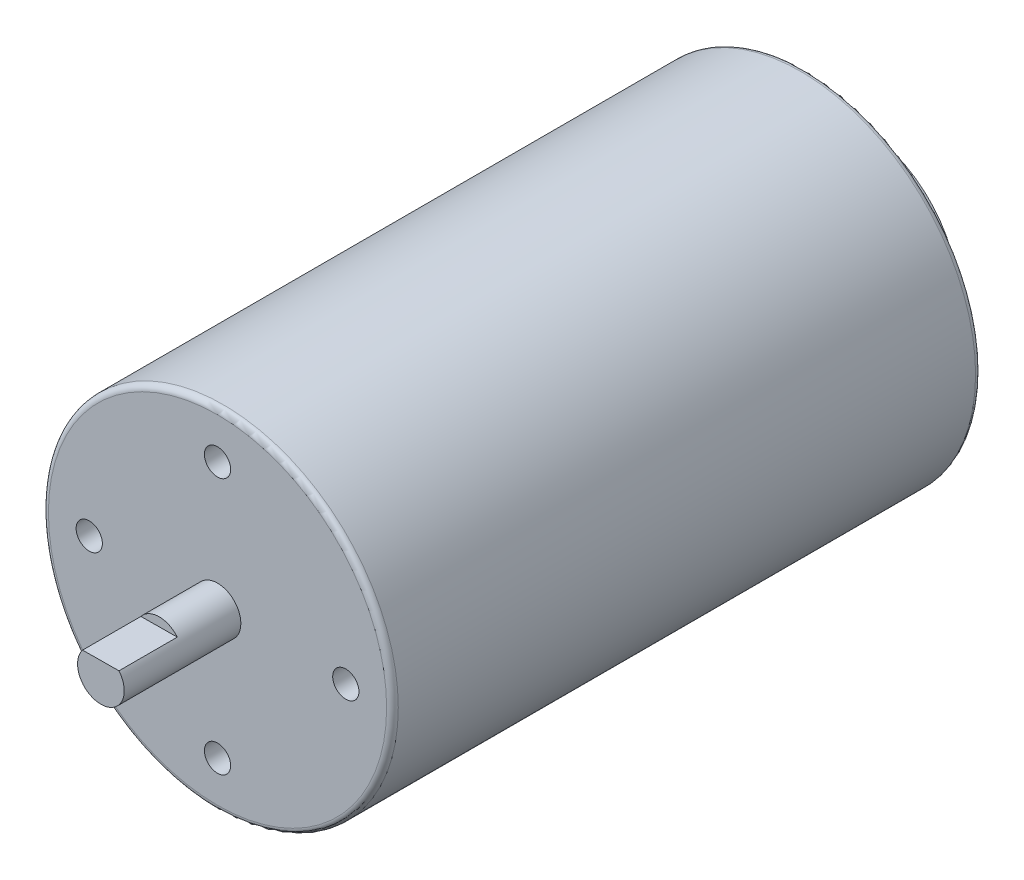
from build123d import *

# Parameters (mm, degrees)
ESQUISSE1_R             = 30
BOSS_EXTRU_1_DEPTH      = 101
ESQUISSE2_R             = 4
BOSS_EXTRU_2_DEPTH      = 20
ENL_V_START             = -10
ENL_V_MAT_EXTRU_1_DEPTH = 10
CONG_1_R                = 1
ESQUISSE4_R             = 17
BOSS_EXTRU_3_DEPTH      = 9
ESQUISSE5_R             = 2.25
ENL_V_MAT_EXTRU_2_DEPTH = 9


with BuildPart() as part:
    # Esquisse1 → Boss.-Extru.1 (new body)
    with BuildSketch(Plane(origin=(0, 0, 0), x_dir=(0, 1, 0), z_dir=(0, 0, 1))):
        Circle(ESQUISSE1_R)
    extrude(amount=BOSS_EXTRU_1_DEPTH)

    # Esquisse2 → Boss.-Extru.2 (add)
    with BuildSketch(Plane.XY.offset(101)):
        Circle(ESQUISSE2_R)
    extrude(amount=BOSS_EXTRU_2_DEPTH)

    # Esquisse3 → Enlèv. mat.-Extru.1 (cut)
    with BuildSketch(Plane.XY.offset(121).offset(ENL_V_START)):
        with BuildLine():
            Line((-3.142677151, 2.4745869), (3.101981411, 2.5254131))
            ThreePointArc((3.101981411, 2.5254131), (-0.032555514, 3.999867515), (-3.142677151, 2.4745869))
        make_face()
    extrude(amount=ENL_V_MAT_EXTRU_1_DEPTH, mode=Mode.SUBTRACT)

    # Congé1
    cong_1_edges = [part.edges().sort_by_distance(p)[0] for p in [
        (0, -30, 0),
        (0, -30, 101),
    ]]
    fillet(cong_1_edges, radius=CONG_1_R)

    # Esquisse4 → Boss.-Extru.3 (add)
    with BuildSketch(Plane(origin=(0, 0, 0), x_dir=(1, 0, 0), z_dir=(0, 0, -1))):
        Circle(ESQUISSE4_R)
    extrude(amount=BOSS_EXTRU_3_DEPTH)

    # Esquisse5 → Enlèv. mat.-Extru.2 (cut)
    with BuildSketch(Plane.XY.offset(101)):
        with Locations((0, 22)):
            Circle(ESQUISSE5_R)
        with Locations((22, 0)):
            Circle(ESQUISSE5_R)
        with Locations((0, -22)):
            Circle(ESQUISSE5_R)
        with Locations((-22, 0)):
            Circle(ESQUISSE5_R)
    extrude(amount=-ENL_V_MAT_EXTRU_2_DEPTH, mode=Mode.SUBTRACT)


solid = part.part
